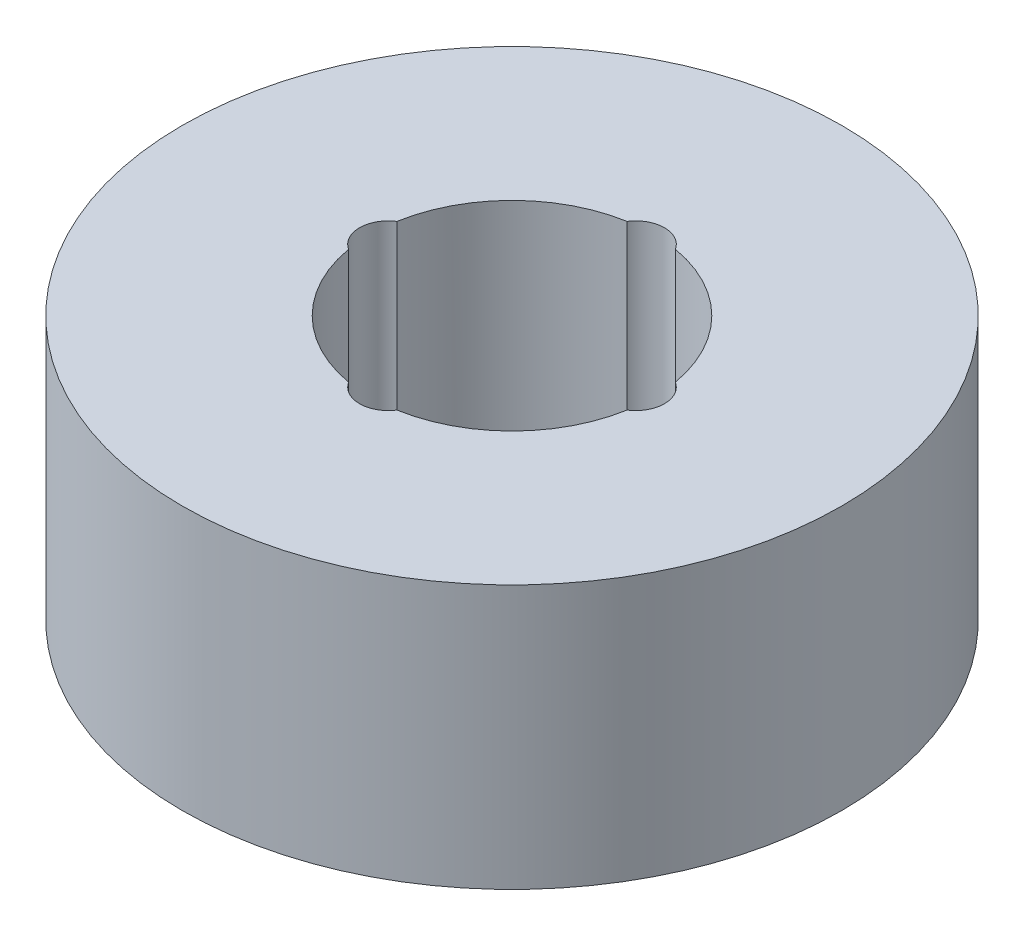
from build123d import *

# Parameters (mm, degrees)
SKETCH1_R           = 17.5
BOSS_EXTRUDE1_DEPTH = 14
SKETCH2_R           = 7.5
CUT_EXTRUDE1_DEPTH  = 29.434134416
SKETCH3_R           = 1.524237751
CUT_EXTRUDE2_DEPTH  = 8.958449647
CIRPATTERN1_COUNT   = 4


with BuildPart() as part:
    # Sketch1 → Boss-Extrude1 (new body)
    with BuildSketch(Plane(origin=(0, 0, 0), x_dir=(1, 0, 0), z_dir=(0, 1, 0))):
        Circle(SKETCH1_R)
    extrude(amount=BOSS_EXTRUDE1_DEPTH)

    # Sketch2 → Cut-Extrude1 (cut, through all)
    with BuildSketch(Plane(origin=(0, 0, 0), x_dir=(1, 0, 0), z_dir=(0, 1, 0))):
        Circle(SKETCH2_R)
    extrude(amount=CUT_EXTRUDE1_DEPTH, mode=Mode.SUBTRACT)

    # Sketch3 → Cut-Extrude2 (cut)
    with BuildSketch(Plane(origin=(0, 14, 0), x_dir=(1, 0, 0), z_dir=(0, 1, 0))):
        with Locations((-6.567368859, 0)):
            Circle(SKETCH3_R)
    cut_extrude2 = extrude(amount=-CUT_EXTRUDE2_DEPTH, mode=Mode.SUBTRACT)

    # CirPattern1: Cut-Extrude2 ×4 about axis
    cirpattern1_axis = Axis((0, 0, 0), (0, 1, 0))
    for i in range(1, CIRPATTERN1_COUNT):
        add(cut_extrude2.rotate(cirpattern1_axis, i * 360 / CIRPATTERN1_COUNT), mode=Mode.SUBTRACT)


solid = part.part
